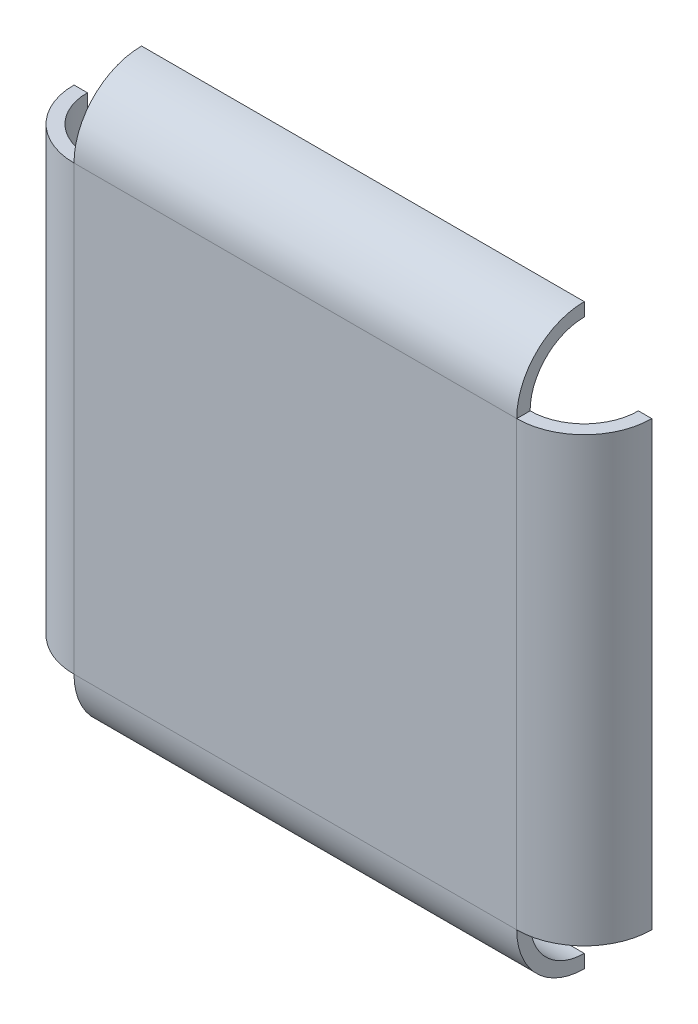
from build123d import *

# Parameters (mm, degrees)
SKETCH1_W                  = 431.8
SKETCH1_H                  = 431.8
BOSS_EXTRUDE1_DEPTH        = 3.175
CONVERT_SOLID2_START       = -431.8
CONVERT_SOLID2_DEPTH       = 431.8
CONVERT_SOLID2_2_DEPTH     = 50.480000066
CONVERT_SOLID2_START_2     = -50.480000066
CONVERT_SOLID2_3_DEPTH     = 50.480000066
CONVERT_SOLID2_START_3     = -381.319999934
CONVERT_SOLID2_4_DEPTH     = 330.839999868
CONVERT_SOLID2_START_4     = -387.436868
CONVERT_SOLID2_5_OUTLINE_W = 330.839999868
CONVERT_SOLID2_5_OUTLINE_H = 6.825
CONVERT_SOLID2_5_DEPTH     = 345.44
CONVERT_SOLID2_START_5     = 50.480000066
CONVERT_SOLID2_6_DEPTH     = 330.839999868


with BuildPart() as part:
    # Sketch1 → Boss-Extrude1 (new body)
    with BuildSketch(Plane.XY):
        with Locations((-215.9, 215.9)):
            Rectangle(SKETCH1_W, SKETCH1_H)
    extrude(amount=BOSS_EXTRUDE1_DEPTH)

    # Convert-Solid2: read off the stored shape, not the designer's step
    # Convert-Solid2 outline → Convert-Solid2 (cut)
    with BuildSketch(Plane.YZ.offset(CONVERT_SOLID2_START)):
        with BuildLine():
            ThreePointArc((32.859915633, 0), (41.528072893, 2.37490942), (50.480000066, 3.175))
            Line((50.480000066, 3.175), (0, 3.175))
            Line((0, 3.175), (0, 0))
            Line((0, 0), (32.859915633, 0))
        make_face()
        with BuildLine():
            Line((431.8, 3.175), (381.319999934, 3.175))
            ThreePointArc((381.319999934, 3.175), (390.271927107, 2.37490942), (398.940084367, 0))
            Line((398.940084367, 0), (431.8, 0))
            Line((431.8, 0), (431.8, 3.175))
        make_face()
    extrude(amount=CONVERT_SOLID2_DEPTH, mode=Mode.SUBTRACT)

    # Convert-Solid2 2 outline → Convert-Solid2 2 (cut)
    with BuildSketch(Plane.YZ.offset(CONVERT_SOLID2_START)):
        with BuildLine():
            Line((32.859915633, 0), (398.940084367, 0))
            ThreePointArc((398.940084367, 0), (390.271927107, 2.37490942), (381.319999934, 3.175))
            Line((381.319999934, 3.175), (50.480000066, 3.175))
            ThreePointArc((50.480000066, 3.175), (41.528072893, 2.37490942), (32.859915633, 0))
        make_face()
    extrude(amount=CONVERT_SOLID2_2_DEPTH, mode=Mode.SUBTRACT)

    # Convert-Solid2 3 outline → Convert-Solid2 3 (cut)
    with BuildSketch(Plane.YZ.offset(CONVERT_SOLID2_START_2)):
        with BuildLine():
            Line((32.859915633, 0), (398.940084367, 0))
            ThreePointArc((398.940084367, 0), (390.271927107, 2.37490942), (381.319999934, 3.175))
            Line((381.319999934, 3.175), (50.480000066, 3.175))
            ThreePointArc((50.480000066, 3.175), (41.528072893, 2.37490942), (32.859915633, 0))
        make_face()
    extrude(amount=CONVERT_SOLID2_3_DEPTH, mode=Mode.SUBTRACT)

    # Convert-Solid2 4 outline → Convert-Solid2 4 (add)
    with BuildSketch(Plane.YZ.offset(CONVERT_SOLID2_START_3)):
        with BuildLine():
            ThreePointArc((10, -47.305000066), (21.856317517, -18.681317517), (50.480000066, -6.825))
            Line((50.480000066, -6.825), (381.319999934, -6.825))
            ThreePointArc((381.319999934, -6.825), (409.943682483, -18.681317517), (421.8, -47.305000066))
            Line((421.8, -47.305000066), (431.8, -47.305000066))
            ThreePointArc((431.8, -47.305000066), (422.778969229, -18.505967588), (398.940084367, 0))
            Line((398.940084367, 0), (32.859915633, 0))
            ThreePointArc((32.859915633, 0), (9.021030771, -18.505967588), (0, -47.305000066))
            Line((0, -47.305000066), (10, -47.305000066))
        make_face()
    extrude(amount=CONVERT_SOLID2_4_DEPTH)

    # Convert-Solid2 5 outline → Convert-Solid2 5 (add)
    with BuildSketch(Plane.YZ.offset(CONVERT_SOLID2_START_4)):
        with Locations((215.9, -3.4125)):
            Rectangle(CONVERT_SOLID2_5_OUTLINE_W, CONVERT_SOLID2_5_OUTLINE_H)
    extrude(amount=CONVERT_SOLID2_5_DEPTH)

    # Convert-Solid2 6 outline → Convert-Solid2 6 (add)
    with BuildSketch(Plane(origin=(0, 0, 0), x_dir=(1, 0, 0), z_dir=(0, 1, 0)).offset(CONVERT_SOLID2_START_5)):
        with BuildLine():
            ThreePointArc((-50.480000066, -3.175), (-14.785249705, 11.610249705), (0, 47.305000066))
            Line((0, 47.305000066), (-10, 47.305000066))
            ThreePointArc((-10, 47.305000066), (-21.856317517, 18.681317517), (-50.480000066, 6.825))
            Line((-50.480000066, 6.825), (-50.480000066, 0))
            Line((-50.480000066, 0), (-50.480000066, -3.175))
        make_face()
        with BuildLine():
            ThreePointArc((-381.319999934, 6.825), (-409.943682483, 18.681317517), (-421.8, 47.305000066))
            Line((-421.8, 47.305000066), (-431.8, 47.305000066))
            ThreePointArc((-431.8, 47.305000066), (-417.014750295, 11.610249705), (-381.319999934, -3.175))
            Line((-381.319999934, -3.175), (-381.319999934, 0))
            Line((-381.319999934, 0), (-381.319999934, 6.825))
        make_face()
    extrude(amount=CONVERT_SOLID2_6_DEPTH)


solid = part.part
